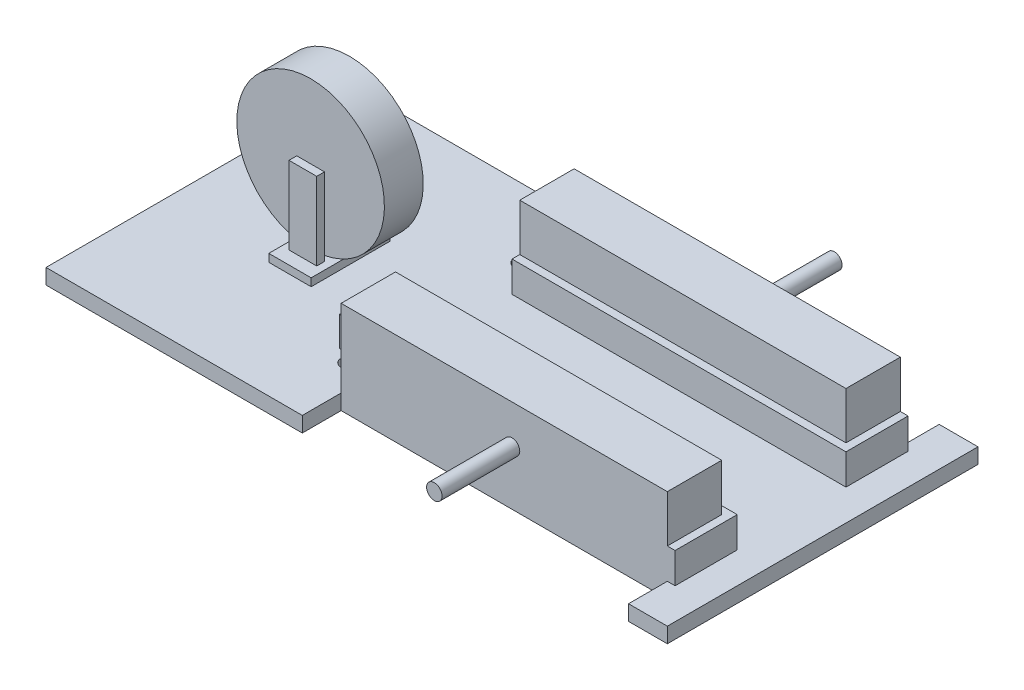
from build123d import *

# Parameters (mm, degrees)
BOSS_EXTRUDE1_DEPTH  = 5
BOSS_EXTRUDE2_DEPTH  = 10
SKETCH3_R            = 2.54
CUT_EXTRUDE1_DEPTH   = 115.031574575
SKETCH5_W            = 13.851899184
SKETCH5_H            = 25.842671822
BOSS_EXTRUDE3_DEPTH  = 2.54
SKETCH6_W            = 9.079065489
SKETCH6_H            = 2.54
BOSS_EXTRUDE7_DEPTH  = 25.4
SKETCH9_R            = 24.13
BOSS_EXTRUDE10_DEPTH = 12.7
SKETCH12_W           = 9.079065489
SKETCH12_H           = 25.611184956
BOSS_EXTRUDE11_DEPTH = 2.54
SKETCH15_W           = 106.68
SKETCH15_H           = 17.78
BOSS_EXTRUDE12_DEPTH = 25.4
SKETCH16_W           = 10.512602145
SKETCH16_H           = 9.55691104
BOSS_EXTRUDE13_DEPTH = 3.81
SKETCH17_R           = 2.54
BOSS_EXTRUDE14_DEPTH = 29.21
BOSS_EXTRUDE15_START = 25.4
SKETCH18_R           = 2.54
BOSS_EXTRUDE15_DEPTH = 25.4


with BuildPart() as part:
    # Sketch1 → Boss-Extrude1 (new body)
    with BuildSketch(Plane(origin=(0, 0, 0), x_dir=(1, 0, 0), z_dir=(0, 1, 0))):
        Polygon((101.6, 50.8), (88.9, 50.8), (88.9, 38.1), (-17.78, 38.1), (-17.78, 50.8), (-101.6, 50.8), (-101.6, -50.8), (-17.78, -50.8), (-17.78, -38.1), (88.9, -38.1), (88.9, -50.8), (101.6, -50.8), align=None)
    extrude(amount=BOSS_EXTRUDE1_DEPTH)

    # Sketch2 → Boss-Extrude2 (add)
    with BuildSketch(Plane(origin=(0, 5, 0), x_dir=(1, 0, 0), z_dir=(0, 1, 0))):
        Polygon((88.9, -38.1), (88.9, -20.32), (-17.78, -20.32), (-17.78, -17.78), (91.44, -17.78), (91.44, -38.1), align=None)
        Polygon((91.44, 17.78), (91.44, 38.1), (88.9, 38.1), (88.9, 20.32), (-17.78, 20.32), (-17.78, 17.78), align=None)
    extrude(amount=BOSS_EXTRUDE2_DEPTH)

    # Sketch3 → Cut-Extrude1 (cut, through all)
    with BuildSketch(Plane(origin=(0, 5, 0), x_dir=(1, 0, 0), z_dir=(0, 1, 0))):
        with Locations((-25.086891482, 28.312348959)):
            Circle(SKETCH3_R)
        with Locations((-25.086891482, -28.312348959)):
            Circle(SKETCH3_R)
    extrude(amount=-CUT_EXTRUDE1_DEPTH, mode=Mode.SUBTRACT)

    # Sketch5 → Boss-Extrude3 (add)
    with BuildSketch(Plane(origin=(0, 5, 0), x_dir=(1, 0, 0), z_dir=(0, 1, 0))):
        with Locations((-59.69, 0)):
            Rectangle(SKETCH5_W, SKETCH5_H)
    extrude(amount=BOSS_EXTRUDE3_DEPTH)

    # Sketch6 → Boss-Extrude7 (add)
    with BuildSketch(Plane(origin=(0, 7.54, 0), x_dir=(1, 0, 0), z_dir=(0, 1, 0))):
        with Locations((-59.730694006, 7.841335911)):
            Rectangle(SKETCH6_W, SKETCH6_H)
    extrude(amount=BOSS_EXTRUDE7_DEPTH)

    # Sketch9 → Boss-Extrude10 (add)
    with BuildSketch(Plane.XY.offset(-6.571335911)):
        with Locations((-59.730694006, 32.94)):
            Circle(SKETCH9_R)
    extrude(amount=BOSS_EXTRUDE10_DEPTH)

    # Sketch12 → Boss-Extrude11 (add)
    with BuildSketch(Plane.XY.offset(6.128664089)):
        with Locations((-59.730694006, 20.134407522)):
            Rectangle(SKETCH12_W, SKETCH12_H)
    extrude(amount=BOSS_EXTRUDE11_DEPTH)

    # Sketch15 → Boss-Extrude12 (add)
    with BuildSketch(Plane(origin=(0, 5, 0), x_dir=(1, 0, 0), z_dir=(0, 1, 0))):
        with Locations((35.56, 29.21)):
            Rectangle(SKETCH15_W, SKETCH15_H)
        with Locations((35.56, -29.21)):
            Rectangle(SKETCH15_W, SKETCH15_H)
    extrude(amount=BOSS_EXTRUDE12_DEPTH)

    # Sketch16 → Boss-Extrude13 (add)
    with BuildSketch(Plane.ZY.offset(17.78)):
        with Locations((-29.626424226, 18.939736786)):
            Rectangle(SKETCH16_W, SKETCH16_H)
        with Locations((29.626424226, 18.939736786)):
            Rectangle(SKETCH16_W, SKETCH16_H)
    extrude(amount=BOSS_EXTRUDE13_DEPTH)

    # Sketch17 → Boss-Extrude14 (add)
    with BuildSketch(Plane(origin=(0, 0, -38.1), x_dir=(-1, 0, 0), z_dir=(0, 0, -1))):
        with Locations((-38.1, 17.7)):
            Circle(SKETCH17_R)
    extrude(amount=BOSS_EXTRUDE14_DEPTH)

    # Sketch18 → Boss-Extrude15 (add)
    with BuildSketch(Plane.XY.offset(38.1).offset(BOSS_EXTRUDE15_START)):
        with Locations((38.1, 17.7)):
            Circle(SKETCH18_R)
    extrude(amount=-BOSS_EXTRUDE15_DEPTH)


solid = part.part
